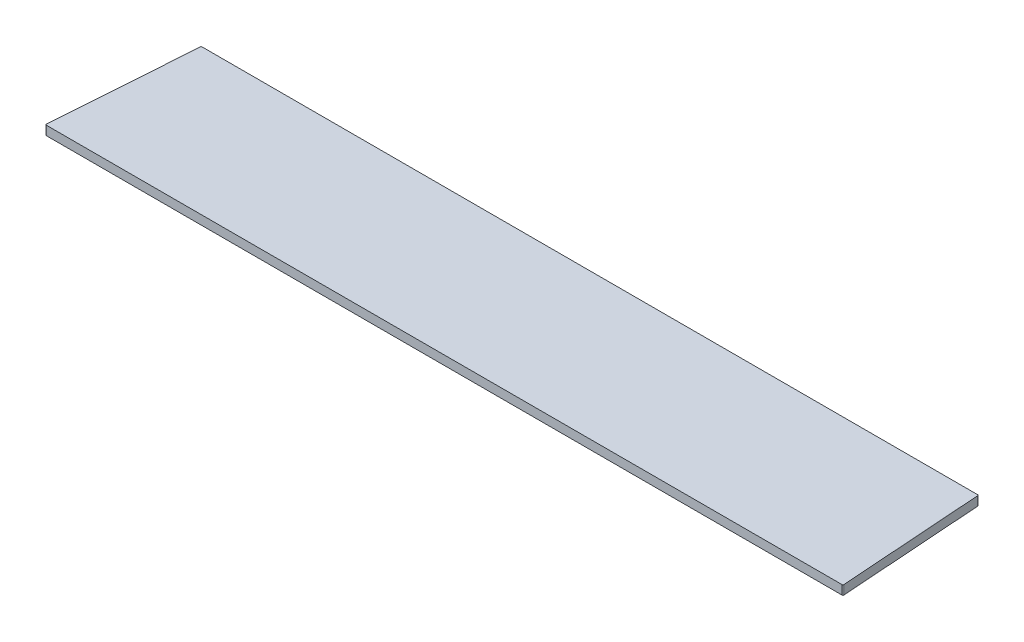
from build123d import *

# Parameters (mm, degrees)
BASE_FLANGE1_DEPTH = 10
FILLET_1_0_R       = 1


# Sheet-metal steps are written as plain solids
with BuildPart() as part:
    # Sketch1 → Base-Flange1 (new body)
    with BuildSketch(Plane(origin=(0, 0, 0), x_dir=(1, 0, 0), z_dir=(0, 1, 0))):
        Polygon((-426.811710089, 160), (426.811710089, 160), (438, 0), (-438, 0), align=None)
    extrude(amount=-BASE_FLANGE1_DEPTH)

    # Fillet-1.0
    fillet_1_0_edges = [part.edges().sort_by_distance(p)[0] for p in [
        (-426.811710089, -5, -160),
        (426.811710089, -5, -160),
        (438, -5, 0),
        (-438, -5, 0),
    ]]
    fillet(fillet_1_0_edges, radius=FILLET_1_0_R)


solid = part.part
